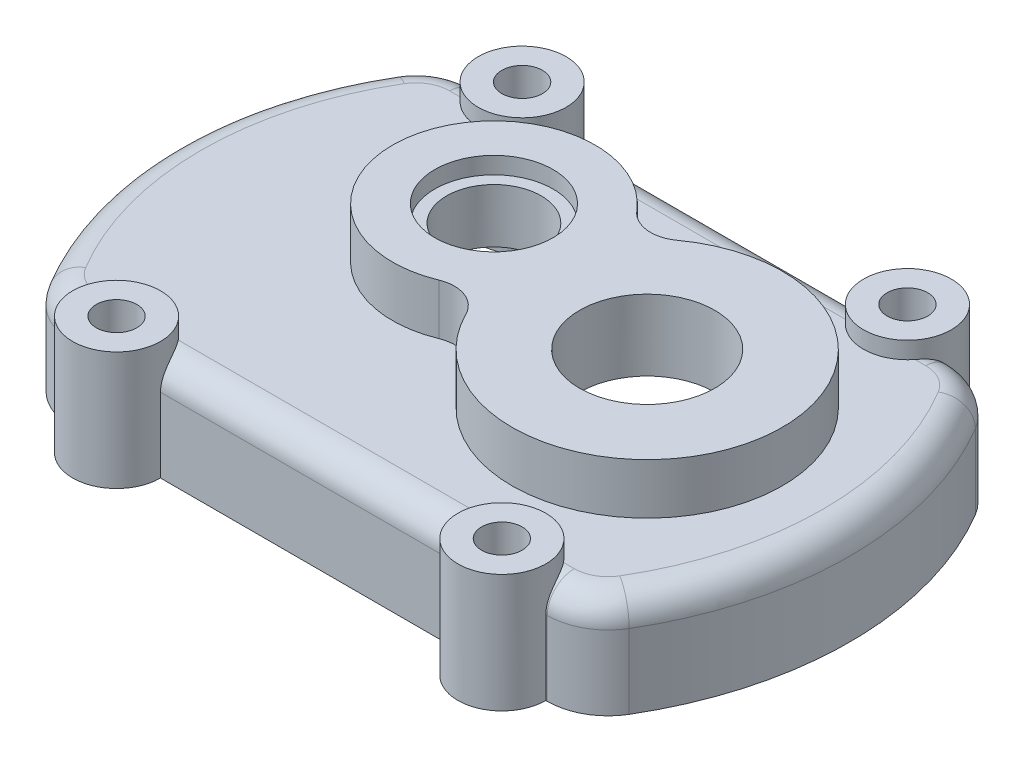
from build123d import *

# Parameters (mm, degrees)
BOSS_EXTRUDE1_DEPTH      = 30
SHELL1_T                 = -6
BOSS_EXTRUDE3_DEPTH      = 5
BOSS_EXTRUDE3_DEPTH_BACK = 30
SKETCH2_R                = 13
SKETCH2_R_2              = 6
SKETCH5_R                = 6
CUT_EXTRUDE1_DEPTH       = 35
FILLET1_R                = 8
BOSS_EXTRUDE4_DEPTH      = 15
SKETCH7_R                = 20
SKETCH7_R_2              = 14
CUT_EXTRUDE3_DEPTH       = 40
SKETCH8_R                = 17.5
CUT_EXTRUDE4_DEPTH       = 5


with BuildPart() as part:
    # Sketch1 → Boss-Extrude1 (new body)
    with BuildSketch(Plane(origin=(0, 0, 0), x_dir=(1, 0, 0), z_dir=(0, 1, 0))):
        with BuildLine():
            Line((-70.427267447, 60), (70.427267447, 60))
            ThreePointArc((70.427267447, 60), (79.316833816, 57.651696705), (85.88691152, 51.219512195))
            ThreePointArc((85.88691152, 51.219512195), (100, 0), (85.88691152, -51.219512195))
            ThreePointArc((85.88691152, -51.219512195), (79.316833816, -57.651696705), (70.427267447, -60))
            Line((70.427267447, -60), (-70.427267447, -60))
            ThreePointArc((-70.427267447, -60), (-79.316833816, -57.651696705), (-85.88691152, -51.219512195))
            ThreePointArc((-85.88691152, -51.219512195), (-100, 0), (-85.88691152, 51.219512195))
            ThreePointArc((-85.88691152, 51.219512195), (-79.316833816, 57.651696705), (-70.427267447, 60))
        make_face()
    extrude(amount=BOSS_EXTRUDE1_DEPTH)

    # Shell1
    shell1_openings = [part.faces().sort_by_distance(p)[0] for p in [
        (0, 0, 0),
    ]]
    offset(amount=SHELL1_T, openings=shell1_openings, kind=Kind.INTERSECTION)

    # Sketch2 → Boss-Extrude3 (add, two sides: drawn at the far end of the back side and taken through both)
    # profile 1 of 4: a face of its own
    with BuildSketch(Plane(origin=(0, 30, 0), x_dir=(1, 0, 0), z_dir=(0, 1, 0)).offset(-BOSS_EXTRUDE3_DEPTH_BACK)):
        with Locations(Location((57, 60, 0), (0, 0, 270))):
            Circle(SKETCH2_R)
        with Locations(Location((57, 60, 0), (0, 0, 270))):
            Circle(SKETCH2_R_2, mode=Mode.SUBTRACT)
    # profile 2 of 4: a face of its own
    with BuildSketch(Plane(origin=(0, 30, 0), x_dir=(1, 0, 0), z_dir=(0, 1, 0)).offset(-BOSS_EXTRUDE3_DEPTH_BACK)):
        with Locations((-57, 60)):
            Circle(SKETCH2_R)
        with Locations(Location((-57, 60, 0), (0, 0, 180))):
            Circle(SKETCH2_R_2, mode=Mode.SUBTRACT)
    # profile 3 of 4: a face of its own
    with BuildSketch(Plane(origin=(0, 30, 0), x_dir=(1, 0, 0), z_dir=(0, 1, 0)).offset(-BOSS_EXTRUDE3_DEPTH_BACK)):
        with Locations(Location((-57, -60, 0), (0, 0, 270))):
            Circle(SKETCH2_R)
        with Locations(Location((-57, -60, 0), (0, 0, 270))):
            Circle(SKETCH2_R_2, mode=Mode.SUBTRACT)
    # profile 4 of 4: a face of its own
    with BuildSketch(Plane(origin=(0, 30, 0), x_dir=(1, 0, 0), z_dir=(0, 1, 0)).offset(-BOSS_EXTRUDE3_DEPTH_BACK)):
        with Locations(Location((57, -60, 0), (0, 0, 180))):
            Circle(SKETCH2_R)
        with Locations((57, -60)):
            Circle(SKETCH2_R_2, mode=Mode.SUBTRACT)
    extrude(amount=BOSS_EXTRUDE3_DEPTH + BOSS_EXTRUDE3_DEPTH_BACK)

    # Sketch5 → Cut-Extrude1 (cut)
    with BuildSketch(Plane(origin=(0, 35, 0), x_dir=(1, 0, 0), z_dir=(0, 1, 0))):
        with Locations(Location((-57, 60, 0), (0, 0, 90))):
            Circle(SKETCH5_R)
        with Locations(Location((-57, -60, 0), (0, 0, 270))):
            Circle(SKETCH5_R)
        with Locations(Location((57, -60, 0), (0, 0, 90))):
            Circle(SKETCH5_R)
        with Locations(Location((57, 60, 0), (0, 0, 270))):
            Circle(SKETCH5_R)
    extrude(amount=-CUT_EXTRUDE1_DEPTH, mode=Mode.SUBTRACT)

    # Fillet1
    # the kernel refuses this fillet: 8 mm, written as the material it takes off along each edge
    with BuildSketch(Plane(origin=(-70.427267447, 30, -42), x_dir=(-0.858869115202879, 0, -0.5121951219512186), z_dir=(-0.5121951219512186, 0, 0.858869115202879))) as fillet1_piece_1:
        with BuildLine():
            CenterArc((18 - FILLET1_R, FILLET1_R), FILLET1_R, 270, 90)
            Line((18 - FILLET1_R, 0), (18, 0))
            Line((18, 0), (18, FILLET1_R))
        make_face()
    revolve(axis=Axis((-70.427267447, 30, -42), (0, -1, 0)), revolution_arc=59.189843357, mode=Mode.SUBTRACT)
    with BuildSketch(Plane(origin=(70.427267447, 30, 60), x_dir=(0, 0, -1), z_dir=(-1, 0, 0))) as fillet1_piece_2_section:
        with BuildLine():
            CenterArc((FILLET1_R, FILLET1_R), FILLET1_R, 180, 90)
            Line((0, FILLET1_R), (0, 0))
            Line((0, 0), (FILLET1_R, 0))
        make_face()
    fillet1_piece_2 = extrude(amount=20.427267447, mode=Mode.PRIVATE)
    fillet1_piece_2 = fillet1_piece_2 - Plane(origin=(57, 28.58355389, 60), x_dir=(-1, 0, 0), z_dir=(0, 1, 0)) * Cylinder(13, 73, mode=Mode.PRIVATE)
    add(fillet1_piece_2, mode=Mode.SUBTRACT)
    with BuildSketch(Plane(origin=(0, 30, 0), x_dir=(-0.8588691152028786, 0, 0.5121951219512192), z_dir=(0.5121951219512192, 0, 0.8588691152028786))) as fillet1_piece_3:
        with BuildLine():
            CenterArc((100 - FILLET1_R, FILLET1_R), FILLET1_R, 270, 90)
            Line((100 - FILLET1_R, 0), (100, 0))
            Line((100, 0), (100, FILLET1_R))
        make_face()
    revolve(axis=Axis((0, 30, 0), (0, -1, 0)), revolution_arc=61.620313286, mode=Mode.SUBTRACT)
    with BuildSketch(Plane(origin=(-70.427267447, 30, 42), x_dir=(0, 0, 1), z_dir=(1, 0, 0))) as fillet1_piece_4:
        with BuildLine():
            CenterArc((18 - FILLET1_R, FILLET1_R), FILLET1_R, 270, 90)
            Line((18 - FILLET1_R, 0), (18, 0))
            Line((18, 0), (18, FILLET1_R))
        make_face()
    revolve(axis=Axis((-70.427267447, 30, 42), (0, -1, 0)), revolution_arc=59.189843357, mode=Mode.SUBTRACT)
    with BuildSketch(Plane(origin=(-50, 30, 60), x_dir=(0, 0, -1), z_dir=(-1, 0, 0))) as fillet1_piece_5_section:
        with BuildLine():
            CenterArc((FILLET1_R, FILLET1_R), FILLET1_R, 180, 90)
            Line((0, FILLET1_R), (0, 0))
            Line((0, 0), (FILLET1_R, 0))
        make_face()
    fillet1_piece_5 = extrude(amount=20.427267447, mode=Mode.PRIVATE)
    fillet1_piece_5 = fillet1_piece_5 - Plane(origin=(-57, 28.583553668, 60), x_dir=(0, 0, 1), z_dir=(0, 1, 0)) * Cylinder(13, 73, mode=Mode.PRIVATE)
    add(fillet1_piece_5, mode=Mode.SUBTRACT)
    with BuildSketch(Plane(origin=(70.427267447, 30, 42), x_dir=(0.8588691152028791, 0, 0.5121951219512185), z_dir=(0.5121951219512185, 0, -0.8588691152028791))) as fillet1_piece_6:
        with BuildLine():
            CenterArc((18 - FILLET1_R, FILLET1_R), FILLET1_R, 270, 90)
            Line((18, FILLET1_R), (18, 0))
            Line((18, 0), (18 - FILLET1_R, 0))
        make_face()
    revolve(axis=Axis((70.427267447, 30, 42), (0, -1, 0)), revolution_arc=59.189843357, mode=Mode.SUBTRACT)
    with BuildSketch(Plane(origin=(0, 30, 0), x_dir=(0.8588691152028793, 0, -0.5121951219512181), z_dir=(-0.5121951219512181, 0, -0.8588691152028793))) as fillet1_piece_7:
        with BuildLine():
            CenterArc((100 - FILLET1_R, FILLET1_R), FILLET1_R, 270, 90)
            Line((100, FILLET1_R), (100, 0))
            Line((100, 0), (100 - FILLET1_R, 0))
        make_face()
    revolve(axis=Axis((0, 30, 0), (0, -1, 0)), revolution_arc=61.620313286, mode=Mode.SUBTRACT)
    with BuildSketch(Plane(origin=(70.427267447, 30, -42), x_dir=(0, 0, -1), z_dir=(-1, 0, 0))) as fillet1_piece_8:
        with BuildLine():
            CenterArc((18 - FILLET1_R, FILLET1_R), FILLET1_R, 270, 90)
            Line((18, FILLET1_R), (18, 0))
            Line((18, 0), (18 - FILLET1_R, 0))
        make_face()
    revolve(axis=Axis((70.427267447, 30, -42), (0, -1, 0)), revolution_arc=59.189843357, mode=Mode.SUBTRACT)
    with BuildSketch(Plane(origin=(-64, 30, -60), x_dir=(0, 0, 1), z_dir=(1, 0, 0))) as fillet1_piece_9_section:
        with BuildLine():
            CenterArc((FILLET1_R, FILLET1_R), FILLET1_R, 180, 90)
            Line((0, FILLET1_R), (0, 0))
            Line((0, 0), (FILLET1_R, 0))
        make_face()
    fillet1_piece_9 = extrude(amount=128, mode=Mode.PRIVATE)
    fillet1_piece_9 = fillet1_piece_9 - Plane(origin=(-57, 28.21841699, -60), x_dir=(1, 0, 0), z_dir=(0, 1, 0)) * Cylinder(13, 288, mode=Mode.PRIVATE)
    fillet1_piece_9 = fillet1_piece_9 - Plane(origin=(57, 28.21841699, -60), x_dir=(0, 0, 1), z_dir=(0, 1, 0)) * Cylinder(13, 288, mode=Mode.PRIVATE)
    add(fillet1_piece_9, mode=Mode.SUBTRACT)
    with BuildSketch(Plane(origin=(-70.427267447, 30, -60), x_dir=(0, 0, 1), z_dir=(1, 0, 0))) as fillet1_piece_10_section:
        with BuildLine():
            CenterArc((FILLET1_R, FILLET1_R), FILLET1_R, 180, 90)
            Line((0, FILLET1_R), (0, 0))
            Line((0, 0), (FILLET1_R, 0))
        make_face()
    fillet1_piece_10 = extrude(amount=20.427267447, mode=Mode.PRIVATE)
    fillet1_piece_10 = fillet1_piece_10 - Plane(origin=(-57, 28.583553949, -60), x_dir=(1, 0, 0), z_dir=(0, 1, 0)) * Cylinder(13, 73, mode=Mode.PRIVATE)
    add(fillet1_piece_10, mode=Mode.SUBTRACT)
    with BuildSketch(Plane(origin=(50, 30, -60), x_dir=(0, 0, 1), z_dir=(1, 0, 0))) as fillet1_piece_11_section:
        with BuildLine():
            CenterArc((FILLET1_R, FILLET1_R), FILLET1_R, 180, 90)
            Line((0, FILLET1_R), (0, 0))
            Line((0, 0), (FILLET1_R, 0))
        make_face()
    fillet1_piece_11 = extrude(amount=20.427267447, mode=Mode.PRIVATE)
    fillet1_piece_11 = fillet1_piece_11 - Plane(origin=(57, 28.583553668, -60), x_dir=(0, 0, 1), z_dir=(0, 1, 0)) * Cylinder(13, 73, mode=Mode.PRIVATE)
    add(fillet1_piece_11, mode=Mode.SUBTRACT)
    with BuildSketch(Plane(origin=(64, 30, 60), x_dir=(0, 0, -1), z_dir=(-1, 0, 0))) as fillet1_piece_12_section:
        with BuildLine():
            CenterArc((FILLET1_R, FILLET1_R), FILLET1_R, 180, 90)
            Line((0, FILLET1_R), (0, 0))
            Line((0, 0), (FILLET1_R, 0))
        make_face()
    fillet1_piece_12 = extrude(amount=128, mode=Mode.PRIVATE)
    fillet1_piece_12 = fillet1_piece_12 - Plane(origin=(-57, 28.21841699, 60), x_dir=(0, 0, 1), z_dir=(0, 1, 0)) * Cylinder(13, 288, mode=Mode.PRIVATE)
    fillet1_piece_12 = fillet1_piece_12 - Plane(origin=(57, 28.21841699, 60), x_dir=(-1, 0, 0), z_dir=(0, 1, 0)) * Cylinder(13, 288, mode=Mode.PRIVATE)
    add(fillet1_piece_12, mode=Mode.SUBTRACT)

    # Sketch6 → Boss-Extrude4 (add)
    with BuildSketch(Plane(origin=(0, 30, 0), x_dir=(1, 0, 0), z_dir=(0, 1, 0))):
        with BuildLine():
            ThreePointArc((4.207246611, -17.857177964), (78.857900978, -9.4901808), (16.468229876, 32.345877555))
            ThreePointArc((16.468229876, 32.345877555), (9.380607501, 30.505174816), (2.938965509, 33.987677645))
            ThreePointArc((2.938965509, 33.987677645), (-49.143425733, 21.771305347), (-8.555706302, -13.077686905))
            ThreePointArc((-8.555706302, -13.077686905), (-1.233963888, -12.95658557), (4.207246611, -17.857177964))
        make_face()
    extrude(amount=BOSS_EXTRUDE4_DEPTH)

    # Sketch7 → Cut-Extrude3 (cut)
    with BuildSketch(Plane(origin=(0, 45, 0), x_dir=(1, 0, 0), z_dir=(0, 1, 0))):
        with Locations(Location((40, 0, 0), (0, 0, 270))):
            Circle(SKETCH7_R)
        with Locations(Location((-20, 14.653669747, 0), (0, 0, 270))):
            Circle(SKETCH7_R_2)
    extrude(amount=-CUT_EXTRUDE3_DEPTH, mode=Mode.SUBTRACT)

    # Sketch8 → Cut-Extrude4 (cut)
    with BuildSketch(Plane(origin=(0, 45, 0), x_dir=(1, 0, 0), z_dir=(0, 1, 0))):
        with Locations(Location((-20, 14.653669747, 0), (0, 0, 270))):
            Circle(SKETCH8_R)
    extrude(amount=-CUT_EXTRUDE4_DEPTH, mode=Mode.SUBTRACT)


solid = part.part
